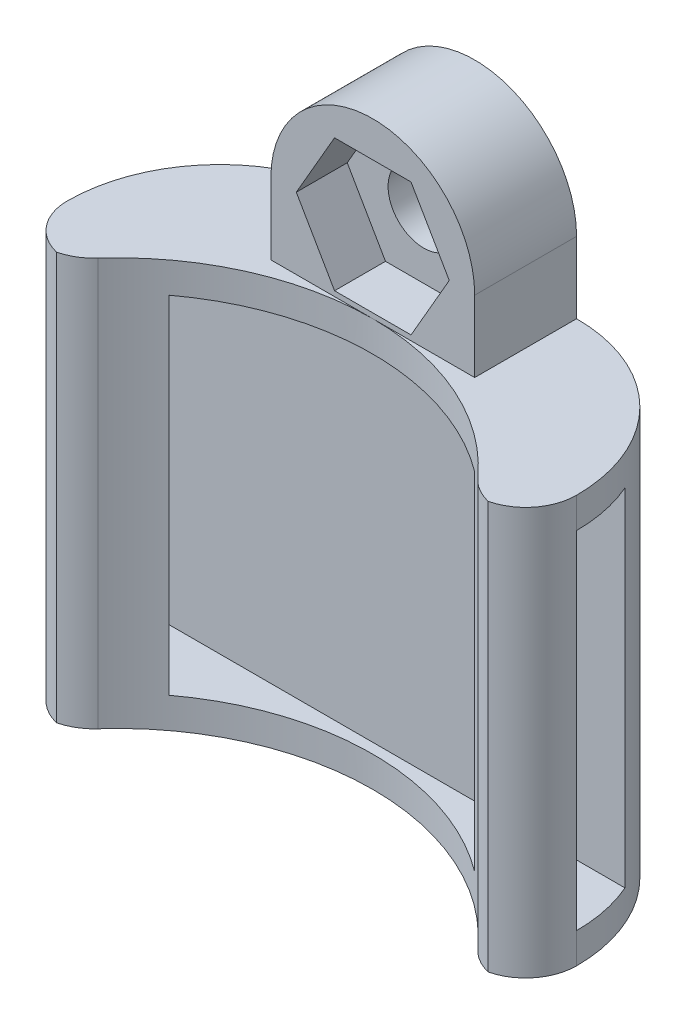
from build123d import *
from build123d.topology import SkipClean

# Parameters (mm, degrees)
ESBO_O1_R                = 1.75
ESBO_O1_W                = 25
ESBO_O1_H                = 20
RESSALTO_EXTRUS_O1_DEPTH = 2.5
RESSALTO_EXTRUS_O2_DEPTH = 20
ESBO_O4_W                = 3
ESBO_O4_H                = 17
CORTE_EXTRUS_O1_DEPTH    = 39
FILETE1_R                = 7.5
FILETE2_R                = 2.5
RESSALTO_EXTRUS_O3_DEPTH = 2.5


with BuildPart() as part:
    # Esboço1 → Ressalto-extrusão1 (new body)
    # profile 1 of 2: a face of its own
    with BuildSketch(Plane.XY):
        with BuildLine():
            Line((5, 0), (5, -3.5))
            Line((5, -3.5), (-5, -3.5))
            Line((-5, -3.5), (-5, 0))
            ThreePointArc((-5, 0), (0, 5), (5, 0))
        make_face()
        Circle(ESBO_O1_R, mode=Mode.SUBTRACT)
    # profile 2 of 2: a face of its own
    with BuildSketch(Plane.XY):
        with Locations((0, -13.5)):
            Rectangle(ESBO_O1_W, ESBO_O1_H)
    extrude(amount=RESSALTO_EXTRUS_O1_DEPTH)

    # Esboço3 → Ressalto-extrusão2 (add)
    with BuildSketch(Plane.XZ.offset(23.5)):
        with BuildLine():
            Line((12.5, 10), (10, 10))
            ThreePointArc((10, 10), (0, 5), (-10, 10))
            Line((-10, 10), (-12.5, 10))
            Line((-12.5, 10), (-12.5, 2.5))
            Line((-12.5, 2.5), (12.5, 2.5))
            Line((12.5, 2.5), (12.5, 10))
        make_face()
    extrude(amount=-RESSALTO_EXTRUS_O2_DEPTH)

    # Esboço4 → Corte-extrusão1 (cut)
    with BuildSketch(Plane.ZY.offset(12.5)):
        with Locations((6, -13.5)):
            Rectangle(ESBO_O4_W, ESBO_O4_H)
    extrude(amount=-CORTE_EXTRUS_O1_DEPTH, mode=Mode.SUBTRACT)

    # Filete1
    # the kernel refuses this fillet: 7.5 mm, written as the material it takes off along each edge
    with BuildSketch(Plane(origin=(-12.5, -42.25, 0), x_dir=(1, 0, 0), z_dir=(0, 1, 0)), Plane(origin=(12.5, 15.25, 0), x_dir=(-1, 0, 0), z_dir=(0, -1, 0))) as filete1_piece_1:
        with BuildLine():
            CenterArc((FILETE1_R, -FILETE1_R), FILETE1_R, 90, 90)
            Line((0, -FILETE1_R), (0, 0))
            Line((0, 0), (FILETE1_R, 0))
        make_face()
    extrude(amount=57.5, mode=Mode.SUBTRACT)

    # Filete2
    # the kernel refuses this fillet: 2.5 mm, written as the material it takes off along each edge
    with BuildSketch(Plane(origin=(10, -26.450849719, 10), x_dir=(1, 0, 0), z_dir=(0, 1, 0))) as filete2_piece_1:
        with BuildLine():
            CenterArc((1.180339887, 2.5), FILETE2_R, 221.810314896, 48.189685104)
            ThreePointArc((-0.683050094, 0.833333333), (-0.332541723, 0.424029939), (0, 0))
            Line((0, 0), (1.180339887, 0))
        make_face()
    extrude(amount=25.901699437, mode=Mode.SUBTRACT)
    with BuildSketch(Plane(origin=(-10, -26.450849719, 10), x_dir=(0.6339223950926707, 0, -0.7733966621339738), z_dir=(0, 1, 0))) as filete2_piece_2:
        with BuildLine():
            CenterArc((1.185247767, 2.497676917), FILETE2_R, 219.340106271, 48.189685104)
            Line((-0.748243889, 0.912870929), (0, 0))
            ThreePointArc((0, 0), (0.538748985, 0.011615415), (1.07749797, 0))
        make_face()
    extrude(amount=25.901699437, mode=Mode.SUBTRACT)
    with BuildSketch(Plane(origin=(12.5, -29.75, 10), x_dir=(0, 0, -1), z_dir=(0, 1, 0)), Plane(origin=(-12.5, -29.75, 10), x_dir=(1, 0, 0), z_dir=(0, 1, 0))) as filete2_piece_3:
        with BuildLine():
            CenterArc((FILETE2_R, FILETE2_R), FILETE2_R, 180, 90)
            Line((0, FILETE2_R), (0, 0))
            Line((0, 0), (FILETE2_R, 0))
        make_face()
    extrude(amount=32.5, mode=Mode.SUBTRACT)

    # Esboço5 → Ressalto-extrusão3 (add)
    # profile 1 of 6: a face of its own
    with SkipClean():  # the faces are left unmerged after this step: merging them gives an invalid solid
        with BuildSketch(Plane.XY.offset(2.5)):
            with BuildLine():
                ThreePointArc((-3.570714214, -3.5), (-4.628907596, -1.890294809), (-5, 0))
                Line((-5, 0), (-5, -3.5))
                Line((-5, -3.5), (-3.570714214, -3.5))
            make_face()
        # profile 2 of 6: a face of its own
        with BuildSketch(Plane.XY.offset(2.5)):
            with BuildLine():
                Line((5, -3.5), (5, 0))
                ThreePointArc((5, 0), (4.628907596, -1.890294809), (3.570714214, -3.5))
                Line((3.570714214, -3.5), (5, -3.5))
            make_face()
        # profile 3 of 6: a face of its own
        with BuildSketch(Plane.XY.offset(2.5)):
            with BuildLine():
                Line((5, -5), (5, -3.5))
                Line((5, -3.5), (3.570714214, -3.5))
                ThreePointArc((3.570714214, -3.5), (1.936491652, -4.609772238), (-4.7e-08, -5))
                Line((-4.7e-08, -5), (5, -5))
            make_face()
        # profile 4 of 6: a face of its own
        with BuildSketch(Plane.XY.offset(2.5)):
            with BuildLine():
                Line((-3.570714214, -3.5), (-5, -3.5))
                Line((-5, -3.5), (-5, -5))
                Line((-5, -5), (-4.7e-08, -5))
                ThreePointArc((-4.7e-08, -5), (-1.936491695, -4.60977222), (-3.570714214, -3.5))
            make_face()
        # profile 5 of 6: a face of its own
        with BuildSketch(Plane.XY.offset(2.5)):
            with BuildLine():
                Line((3.570714214, -3.5), (-3.570714214, -3.5))
                ThreePointArc((-3.570714214, -3.5), (-1.936491695, -4.60977222), (-4.7e-08, -5))
                ThreePointArc((-4.7e-08, -5), (1.936491652, -4.609772238), (3.570714214, -3.5))
            make_face()
        # profile 6 of 6: a face of its own
        with BuildSketch(Plane.XY.offset(2.5)):
            with BuildLine():
                ThreePointArc((5, 0), (0, 5), (-5, 0))
                ThreePointArc((-5, 0), (-4.628907596, -1.890294809), (-3.570714214, -3.5))
                Line((-3.570714214, -3.5), (3.570714214, -3.5))
                ThreePointArc((3.570714214, -3.5), (4.628907596, -1.890294809), (5, 0))
            make_face()
            Polygon((1.876388375, 3.25), (3.75277675, 0), (1.876388375, -3.25), (-1.876388375, -3.25), (-3.75277675, 0), (-1.876388375, 3.25), align=None, mode=Mode.SUBTRACT)
        extrude(amount=RESSALTO_EXTRUS_O3_DEPTH)


solid = part.part
